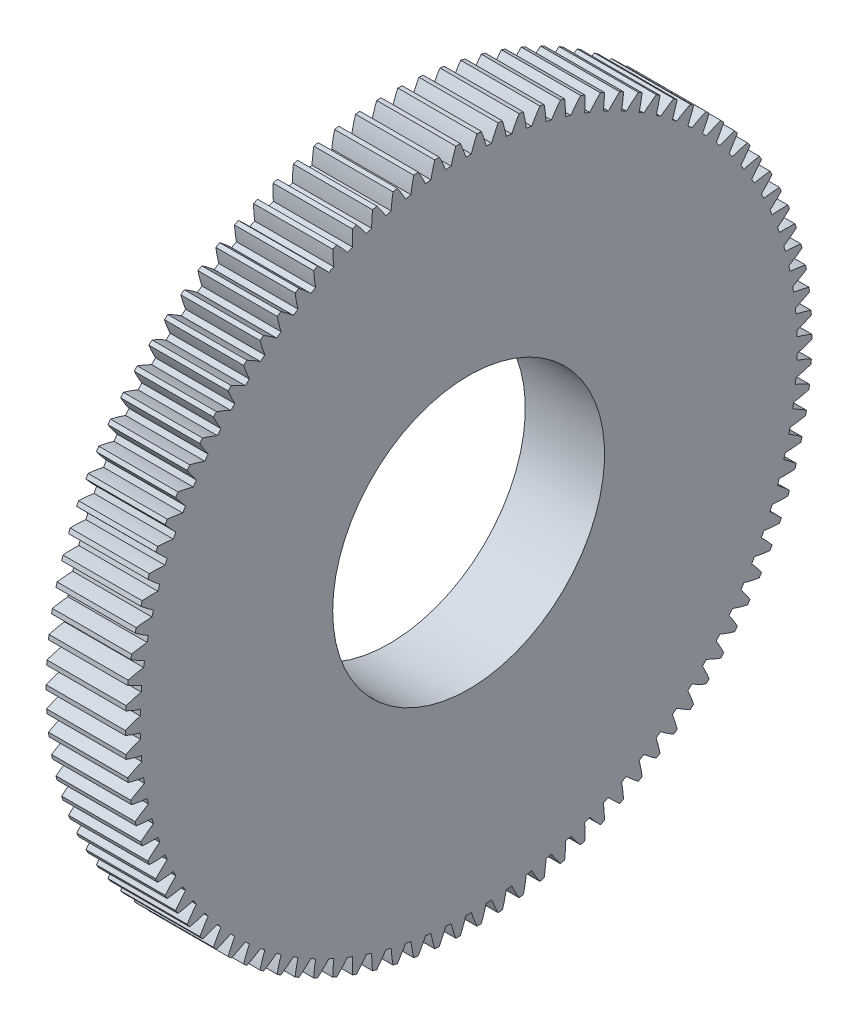
from build123d import *

# Parameters (mm, degrees)
BASPROSKE_W        = 15.24
BASPROSKE_H        = 66.04
TOOTHCUT_DEPTH     = 95.629914932
TEETHCUTS_COUNT    = 102
TEETHCUTS_ANGLE    = 356.470588235
BORSKE_R           = 0.396875
BORE_DEPTH         = 50.8000508
SKETCH1_R          = 26.153120593
CUT_EXTRUDE1_DEPTH = 95.616152603


with BuildPart() as part:
    # BasProSke → Base-Revolve (revolve)
    with BuildSketch(Plane(origin=(0, 0, 0), x_dir=(1, 0, 0), z_dir=(0, 1, 0))):
        with Locations((7.62, 33.02)):
            Rectangle(BASPROSKE_W, BASPROSKE_H)
    revolve(axis=Axis((-10, 0, 0), (1, 0, 0)))

    # TooCutSke → ToothCut (cut, through all)
    with BuildSketch(Plane(origin=(0, 0, 0), x_dir=(0, 0, -1), z_dir=(1, 0, 0))):
        with BuildLine():
            ThreePointArc((0.534790556, 63.192937122), (0, 63.1952), (-0.534790556, 63.192937122))
            ThreePointArc((-0.534790556, 63.192937122), (-1.037913992, 64.635251799), (-1.625165547, 66.045407971))
            ThreePointArc((-1.625165547, 66.045407971), (0, 66.0654), (1.625165547, 66.045407971))
            ThreePointArc((1.625165547, 66.045407971), (1.037913992, 64.635251799), (0.534790556, 63.192937122))
        make_face()
    toothcut = extrude(amount=TOOTHCUT_DEPTH, mode=Mode.SUBTRACT)

    # TeethCuts: ToothCut ×102 about axis
    teethcuts_axis = Axis((-10, 0, 0), (1, 0, 0))
    for i in range(1, TEETHCUTS_COUNT):
        add(toothcut.rotate(teethcuts_axis, i * TEETHCUTS_ANGLE / (TEETHCUTS_COUNT - 1)), mode=Mode.SUBTRACT)

    # BorSke → Bore (cut, symmetric)
    with BuildSketch(Plane(origin=(0, 0, 0), x_dir=(0, 0, -1), z_dir=(1, 0, 0))):
        Circle(BORSKE_R)
    extrude(amount=BORE_DEPTH, both=True, mode=Mode.SUBTRACT)

    # Sketch1 → Cut-Extrude1 (cut, through all)
    with BuildSketch(Plane.ZY):
        with Locations((0, 0.396875)):
            Circle(SKETCH1_R)
    extrude(amount=-CUT_EXTRUDE1_DEPTH, mode=Mode.SUBTRACT)


solid = part.part
